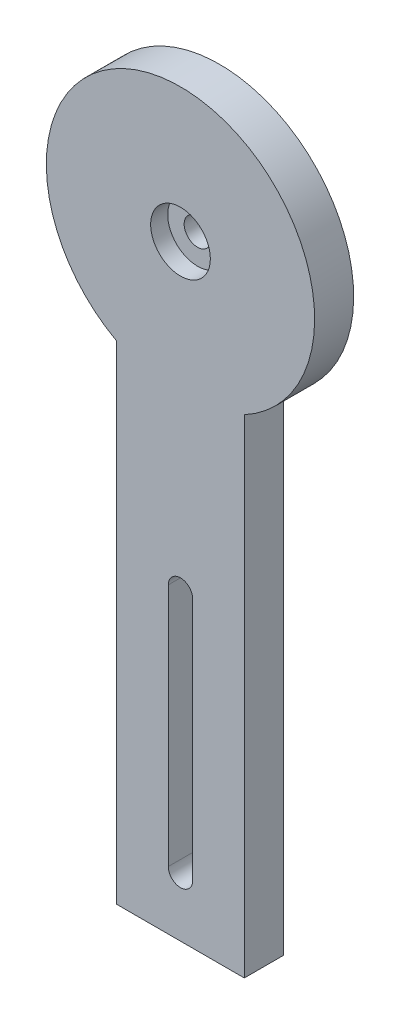
from build123d import *

# Parameters (mm, degrees)
ESTRUSIONE_ESTRUSIONE1_DEPTH                         = 4
TAGLIO_ESTRUSIONE1_DEPTH                             = 158.227985838
FORO_LAMATO_PER_BULLONE_M5_A_TESTA_ESAGO_D           = 5.5
FORO_LAMATO_PER_BULLONE_M5_A_TESTA_ESAGO_CBORE_D     = 12.238
FORO_LAMATO_PER_BULLONE_M5_A_TESTA_ESAGO_CBORE_DEPTH = 3.5


with BuildPart() as part:
    # Schizzo1 → Estrusione-Estrusione1 (new, symmetric)
    with BuildSketch(Plane.XY):
        with BuildLine():
            Line((0, 0), (0, 100))
            ThreePointArc((0, 100), (13.08, 151.690155022), (26.16, 100))
            Line((26.16, 100), (26.16, 0))
            Line((26.16, 0), (0, 0))
        make_face()
    extrude(amount=ESTRUSIONE_ESTRUSIONE1_DEPTH, both=True)

    # Schizzo2 → Taglio-Estrusione1 (cut, through all)
    with BuildSketch(Plane.XY.offset(4)):
        with BuildLine():
            Line((10.58, 12), (10.58, 62))
            ThreePointArc((10.58, 62), (13.08, 64.5), (15.58, 62))
            Line((15.58, 62), (15.58, 12))
            ThreePointArc((15.58, 12), (13.08, 9.5), (10.58, 12))
        make_face()
    extrude(amount=-TAGLIO_ESTRUSIONE1_DEPTH, mode=Mode.SUBTRACT)

    # Foro lamato per Bullone M5 a testa esagonale-1 (through all)
    with Locations(Plane.XY.offset(4)):
        with Locations((13.08, 124.190155022)):
            CounterBoreHole(FORO_LAMATO_PER_BULLONE_M5_A_TESTA_ESAGO_D / 2, FORO_LAMATO_PER_BULLONE_M5_A_TESTA_ESAGO_CBORE_D / 2, FORO_LAMATO_PER_BULLONE_M5_A_TESTA_ESAGO_CBORE_DEPTH)


solid = part.part
